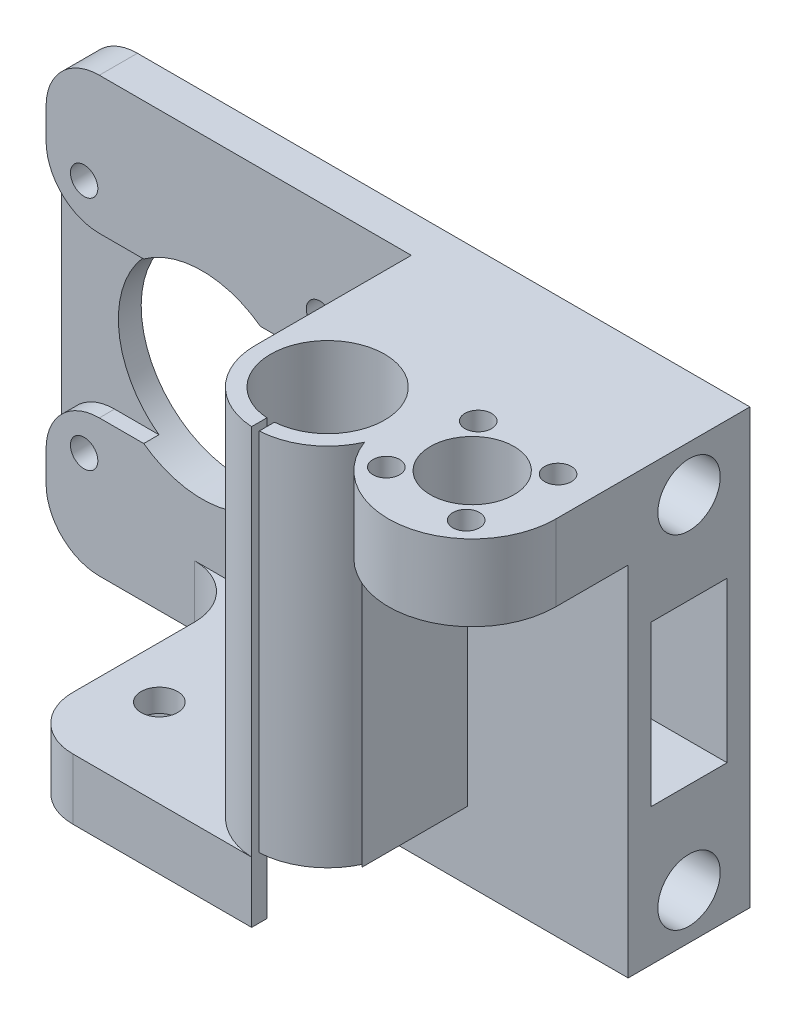
from build123d import *

# Parameters (mm, degrees)
SKETCH2_R             = 1.75
SKETCH2_R_2           = 5.5
BOSS_EXTRUDE1_DEPTH   = 28.5
CUT_EXTRUDE1_START    = 16
CUT_EXTRUDE1_DEPTH    = 83.998737366
SKETCH4_R             = 1.8
SKETCH4_R_2           = 13
HOLES_FOR_MOTOR_DEPTH = 99.998737366
BOSS_EXTRUDE2_START   = -20.5
BOSS_EXTRUDE2_DEPTH   = 8
SKETCH6_W             = 10
SKETCH6_H             = 21
CUT_EXTRUDE3_DEPTH    = 99.998737366
M4_CLEARANCE_HOLE1_D  = 4.8
CUT_EXTRUDE6_START    = -3
CUT_EXTRUDE6_DEPTH    = 3.4
FILLET1_R             = 7
SKETCH11_R            = 4.1
CUT_EXTRUDE7_DEPTH    = 21.691


with BuildPart() as part:
    # Sketch2 → Boss-Extrude1 (new, symmetric)
    with BuildSketch(Plane(origin=(0, 0, 0), x_dir=(1, 0, 0), z_dir=(0, 1, 0))):
        with BuildLine():
            Line((87.5, 0), (0, 0))
            Line((0, 0), (0, -5))
            Line((0, -5), (48, -5))
            Line((48, -5), (48, -25.5))
            ThreePointArc((48, -25.5), (50.607975624, -32.038348415), (57, -34.986832981))
            Line((57, -34.986832981), (57, -32.983314774))
            ThreePointArc((57, -32.983314774), (57.5, -18), (58, -32.983314774))
            Line((58, -32.983314774), (58, -34.986832981))
            ThreePointArc((58, -34.986832981), (62.894319797, -33.319930558), (66.190789474, -29.336688458))
            ThreePointArc((66.190789474, -29.336688458), (78.449190115, -36.325925267), (87.5, -25.5))
            Line((87.5, -25.5), (87.5, 0))
        make_face()
        with Locations((70.462323358, -30.748472232)):
            Circle(SKETCH2_R, mode=Mode.SUBTRACT)
        with Locations((81.748472232, -31.537676642)):
            Circle(SKETCH2_R, mode=Mode.SUBTRACT)
        with Locations((76.5, -25.5)):
            Circle(SKETCH2_R_2, mode=Mode.SUBTRACT)
        with Locations((71.251527768, -19.462323358)):
            Circle(SKETCH2_R, mode=Mode.SUBTRACT)
        with Locations((82.537676642, -20.251527768)):
            Circle(SKETCH2_R, mode=Mode.SUBTRACT)
    extrude(amount=BOSS_EXTRUDE1_DEPTH, both=True)

    # Sketch3 → Cut-Extrude1 (cut, through all)
    with BuildSketch(Plane.XY.offset(CUT_EXTRUDE1_START)):
        Polygon((66.4, 18.5), (88, 18.5), (88, -28.5), (57.1, -28.5), (57.1, -19.5), (66.4, -19.5), align=None)
    extrude(amount=CUT_EXTRUDE1_DEPTH, mode=Mode.SUBTRACT)

    # Sketch4 → Holes-for-motor (cut, through all)
    with BuildSketch(Plane.XY):
        with Locations((5, 15.5)):
            Circle(SKETCH4_R)
        with Locations((36, 15.5)):
            Circle(SKETCH4_R)
        with Locations((5, -15.5)):
            Circle(SKETCH4_R)
        with Locations((36, -15.5)):
            Circle(SKETCH4_R)
        with Locations((20.5, 0)):
            Circle(SKETCH4_R_2)
    extrude(amount=HOLES_FOR_MOTOR_DEPTH, mode=Mode.SUBTRACT)

    # Sketch5 → Boss-Extrude2 (add)
    with BuildSketch(Plane(origin=(0, 0, 0), x_dir=(1, 0, 0), z_dir=(0, 1, 0)).offset(BOSS_EXTRUDE2_START)):
        with BuildLine():
            Line((26.5, -4.986832981), (26.5, -34.986832981))
            Line((26.5, -34.986832981), (57, -34.986832981))
            ThreePointArc((57, -34.986832981), (50.607975624, -32.038348415), (48, -25.5))
            Line((48, -25.5), (48, -4.986832981))
            Line((48, -4.986832981), (26.5, -4.986832981))
        make_face()
    extrude(amount=-BOSS_EXTRUDE2_DEPTH)

    # Sketch6 → Cut-Extrude3 (cut, through all)
    with BuildSketch(Plane(origin=(0, 0, 0), x_dir=(0, 0, -1), z_dir=(1, 0, 0))):
        with Locations((-8, 0)):
            Rectangle(SKETCH6_W, SKETCH6_H)
    extrude(amount=CUT_EXTRUDE3_DEPTH, mode=Mode.SUBTRACT)

    # M4 Clearance Hole1 (through all)
    with Locations(Plane(origin=(0, -20.5, 0), x_dir=(1, 0, 0), z_dir=(0, 1, 0))):
        with Locations((33.28379107, -23.399836079)):
            Hole(M4_CLEARANCE_HOLE1_D / 2)

    # Sketch10 → Cut-Extrude6 (cut)
    with BuildSketch(Plane(origin=(0, -20.5, 0), x_dir=(1, 0, 0), z_dir=(0, 1, 0)).offset(CUT_EXTRUDE6_START)):
        Polygon((39.840713008, -23.399836079), (37.762252039, -19.799836079), (22.762252039, -19.799836079), (22.762252039, -26.999836079), (37.762252039, -26.999836079), align=None)
    extrude(amount=-CUT_EXTRUDE6_DEPTH, mode=Mode.SUBTRACT)

    # Fillet1
    fillet1_edges = [part.edges().sort_by_distance(p)[0] for p in [
        (0, -28.5, 2.5),
        (0, 28.5, 2.5),
        (26.5, -24.5, 34.986832981),
        (0, 10.5, 4),
        (0, -10.5, 4),
        (26.5, -24.5, 5),
    ]]
    fillet(fillet1_edges, radius=FILLET1_R)

    # Sketch11 → Cut-Extrude7 (cut)
    with BuildSketch(Plane(origin=(87.5, 0, 0), x_dir=(0, 0, -1), z_dir=(1, 0, 0))):
        with Locations((-8, -22.5)):
            Circle(SKETCH11_R)
        with Locations((-8, 22.5)):
            Circle(SKETCH11_R)
    extrude(amount=-CUT_EXTRUDE7_DEPTH, mode=Mode.SUBTRACT)


solid = part.part
